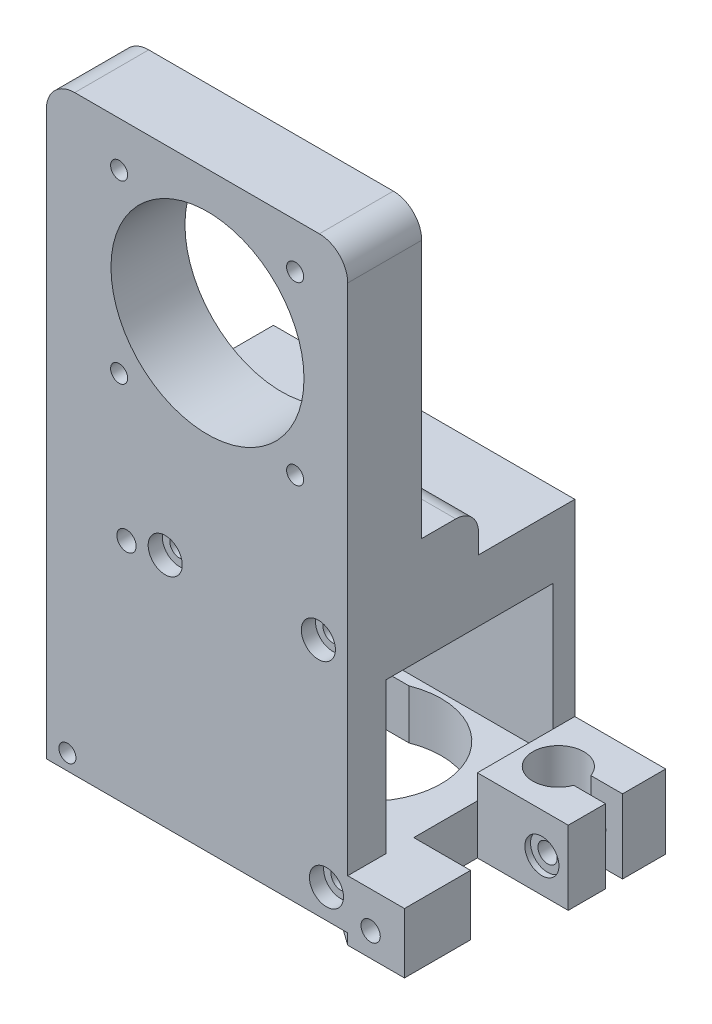
from build123d import *
from OCP.BRepAlgoAPI import BRepAlgoAPI_Cut
from OCP.TopTools import TopTools_ListOfShape

# Parameters (mm, degrees)
SKETCH1_W                     = 45
SKETCH1_H                     = 45
BOSS_EXTRUDE1_DEPTH           = 35
SKETCH2_R                     = 13
CUT_EXTRUDE3_DEPTH            = 35
SKETCH4_R                     = 1.7
CUT_EXTRUDE8_DEPTH            = 35
SKETCH7_R                     = 1.7
CUT_EXTRUDE9_DEPTH            = 35
SKETCH6_R                     = 1.7
CUT_EXTRUDE10_DEPTH           = 35
SKETCH5_R                     = 1.7
CUT_EXTRUDE11_DEPTH           = 35
CUT_EXTRUDE12_DEPTH           = 12
BOSS_EXTRUDE4_DEPTH           = 2
BOSS_EXTRUDE4_DEPTH_BACK      = 37.5
SKETCH14_W                    = 6
SKETCH14_H                    = 6
CUT_EXTRUDE17_START           = -7
SKETCH20_R                    = 2.2
CUT_EXTRUDE17_DEPTH           = 70.77141069
SKETCH21_R                    = 1.75
CUT_EXTRUDE18_DEPTH           = 2
BOSS_EXTRUDE5_DEPTH           = 44.571207257
BOSS_EXTRUDE5_DEPTH_BACK      = 1.562633388
SKETCH22_W                    = 53.082637552
SKETCH22_H                    = 40.002520942
SKETCH23_W                    = 29.449729346
SKETCH23_H                    = 26.517519529
CUT_EXTRUDE19_DEPTH           = 95.427299018
SKETCH25_R                    = 5
CUT_EXTRUDE24_DEPTH           = 2.6
SKETCH26_R                    = 8.1
CUT_EXTRUDE25_DEPTH           = 4
SKETCH27_R                    = 6.7
CUT_EXTRUDE28_DEPTH           = 6
SKETCH30_R                    = 13
CUT_EXTRUDE30_DEPTH           = 10.767560088
SKETCH31_W                    = 19.349450051
SKETCH31_H                    = 23.644133728
CUT_EXTRUDE31_DEPTH           = 9.664293754
SKETCH34_R                    = 1.5
CUT_EXTRUDE32_DEPTH           = 9
SKETCH37_W                    = 11.635024897
SKETCH37_H                    = 10.599921236
BOSS_EXTRUDE6_DEPTH           = 10
BOSS_EXTRUDE6_OTHER_WAY_DEPTH = 5
BOSS_EXTRUDE6_OTHER_WAY_TAPER = 29
SKETCH38_R                    = 1.700000001
CUT_EXTRUDE33_DEPTH           = 10
SKETCH39_R                    = 1.700000001
CUT_EXTRUDE34_DEPTH           = 88.0662855
SKETCH40_W                    = 17.159872711
SKETCH40_H                    = 13
BOSS_EXTRUDE7_DEPTH           = 16
SKETCH41_R                    = 4.5
CUT_EXTRUDE35_DEPTH           = 15
SKETCH42_W                    = 9.331425876
SKETCH42_H                    = 3
CUT_EXTRUDE36_DEPTH           = 15
CUT_EXTRUDE37_DEPTH           = 5
SKETCH44_R                    = 1.7
CUT_EXTRUDE38_DEPTH           = 23
CUT_EXTRUDE39_DEPTH           = 5
CUT_EXTRUDE40_DEPTH           = 5
CUT_EXTRUDE41_DEPTH           = 5
SKETCH53_R                    = 1.7
CUT_EXTRUDE42_DEPTH           = 90.646740997
SKETCH52_R                    = 1.7
CUT_EXTRUDE43_DEPTH           = 90.646740997
SKETCH51_R                    = 1.7
CUT_EXTRUDE44_DEPTH           = 90.646740997
CUT_EXTRUDE46_DEPTH           = 5
SKETCH57_R                    = 3
CUT_EXTRUDE48_DEPTH           = 2.5
SKETCH58_R                    = 3
CUT_EXTRUDE49_DEPTH           = 2.5
SKETCH59_R                    = 3
CUT_EXTRUDE50_DEPTH           = 2.5
SKETCH60_R                    = 3
CUT_EXTRUDE51_DEPTH           = 1
SKETCH61_W                    = 6.542017971
SKETCH61_H                    = 14.030300317
CUT_EXTRUDE52_DEPTH           = 6.5
SKETCH67_W                    = 5.604230097
SKETCH67_H                    = 8.996545788
BOSS_EXTRUDE8_DEPTH           = 33
SKETCH68_W                    = 5.604230097
SKETCH68_H                    = 9.400155495
BOSS_EXTRUDE9_DEPTH           = 33
SKETCH63_R                    = 1.7
CUT_EXTRUDE55_DEPTH           = 102.92049818
SKETCH62_R                    = 1.7
CUT_EXTRUDE56_DEPTH           = 102.92049818
SKETCH69_R                    = 3
CUT_EXTRUDE57_DEPTH           = 2.5
CUT_EXTRUDE58_DEPTH           = 2.5
SKETCH71_R                    = 3
CUT_EXTRUDE59_DEPTH           = 1
SKETCH73_R                    = 1.5
CUT_EXTRUDE61_DEPTH           = 5
SKETCH79_W                    = 95.658931194
SKETCH79_H                    = 51.290788201
CUT_EXTRUDE62_DEPTH           = 59
SKETCH80_W                    = 53.082637552
SKETCH80_H                    = 13.031868173
BOSS_EXTRUDE10_DEPTH          = 58
FILLET1_R                     = 5
SKETCH84_R                    = 17
CUT_EXTRUDE63_DEPTH           = 22
SKETCH85_R                    = 1.5
CUT_EXTRUDE64_DEPTH           = 15
SKETCH86_W                    = 13.696128452
SKETCH86_H                    = 10
BOSS_EXTRUDE11_DEPTH          = 7.5
FILLET3_R                     = 3
SKETCH87_W                    = 10.765748292
SKETCH87_H                    = 10
BOSS_EXTRUDE12_DEPTH          = 7.5
FILLET6_R                     = 4


with BuildPart() as part:
    # Sketch1 → Boss-Extrude1 (new body)
    with BuildSketch(Plane.XY):
        Rectangle(SKETCH1_W, SKETCH1_H)
    extrude(amount=BOSS_EXTRUDE1_DEPTH)

    # Sketch2 → Cut-Extrude3 (cut)
    with BuildSketch(Plane.XY.offset(35)):
        Circle(SKETCH2_R)
    extrude(amount=-CUT_EXTRUDE3_DEPTH, mode=Mode.SUBTRACT)

    # Sketch4 → Cut-Extrude8 (cut)
    with BuildSketch(Plane(origin=(0, 0, 0), x_dir=(-1, 0, 0), z_dir=(0, 0, -1))):
        with Locations((-15.808862622, 15.928817575)):
            Circle(SKETCH4_R)
    extrude(amount=-CUT_EXTRUDE8_DEPTH, mode=Mode.SUBTRACT)

    # Sketch7 → Cut-Extrude9 (cut)
    with BuildSketch(Plane(origin=(0, 0, 0), x_dir=(-1, 0, 0), z_dir=(0, 0, -1))):
        with Locations((15.199970606, 15.923392722)):
            Circle(SKETCH7_R)
    extrude(amount=-CUT_EXTRUDE9_DEPTH, mode=Mode.SUBTRACT)

    # Sketch6 → Cut-Extrude10 (cut)
    with BuildSketch(Plane(origin=(0, 0, 0), x_dir=(-1, 0, 0), z_dir=(0, 0, -1))):
        with Locations((15.22029943, -15.065721832)):
            Circle(SKETCH6_R)
    extrude(amount=-CUT_EXTRUDE10_DEPTH, mode=Mode.SUBTRACT)

    # Sketch5 → Cut-Extrude11 (cut)
    with BuildSketch(Plane(origin=(0, 0, 0), x_dir=(-1, 0, 0), z_dir=(0, 0, -1))):
        with Locations((-15.781319068, -15.06525873)):
            Circle(SKETCH5_R)
    extrude(amount=-CUT_EXTRUDE11_DEPTH, mode=Mode.SUBTRACT)

    # Sketch8 → Cut-Extrude12 (cut)
    with BuildSketch(Plane(origin=(22.5, 0, 0), x_dir=(0, 0, -1), z_dir=(1, 0, 0))):
        Polygon((-4.363915061, -12.036124724), (-35, -12.036124724), (-35, 22.5), (-8.423058519, 22.5), (-8.423058519, 12.925541512), (-4.363915061, 12.925541512), align=None)
    extrude(amount=-CUT_EXTRUDE12_DEPTH, mode=Mode.SUBTRACT)

    # Sketch14 → Boss-Extrude4 (add, two sides: drawn at the far end of the back side and taken through both)
    with BuildSketch(Plane(origin=(0, 22.5, 0), x_dir=(1, 0, 0), z_dir=(0, 1, 0)).offset(-BOSS_EXTRUDE4_DEPTH_BACK)):
        with Locations((6.190916669, -17.729312446)):
            Rectangle(SKETCH14_W, SKETCH14_H)
    extrude(amount=BOSS_EXTRUDE4_DEPTH + BOSS_EXTRUDE4_DEPTH_BACK)

    # Sketch20 → Cut-Extrude17 (cut)
    with BuildSketch(Plane(origin=(0, 24.5, 0), x_dir=(1, 0, 0), z_dir=(0, 1, 0)).offset(CUT_EXTRUDE17_START)):
        with Locations((6.190916669, -17.729312446)):
            Circle(SKETCH20_R)
    cut_extrude17 = extrude(amount=CUT_EXTRUDE17_DEPTH, mode=Mode.SUBTRACT)

    # Sketch21 → Cut-Extrude18 (cut)
    with BuildSketch(Plane(origin=(0, 17.5, 0), x_dir=(1, 0, 0), z_dir=(0, 1, 0))):
        with Locations((6.190916669, -17.729312446)):
            Circle(SKETCH21_R)
    extrude(amount=-CUT_EXTRUDE18_DEPTH, mode=Mode.SUBTRACT)

    # Mirror6: Cut-Extrude17 across plane
    add(cut_extrude17.mirror(Plane.ZX.offset(16.5)), mode=Mode.SUBTRACT)

    # Sketch22 → Boss-Extrude5 (add, two sides: drawn at the far end of the back side and taken through both)
    with BuildSketch(Plane.XZ.offset(22.5).offset(-BOSS_EXTRUDE5_DEPTH_BACK)):
        with Locations((-1.541318776, 20.001258793)):
            Rectangle(SKETCH22_W, SKETCH22_H)
    extrude(amount=BOSS_EXTRUDE5_DEPTH + BOSS_EXTRUDE5_DEPTH_BACK)

    # Sketch23 → Cut-Extrude19 (cut, through all)
    with BuildSketch(Plane.ZY.offset(28.082637552)):
        with Locations((18.529138975, -45.100264067)):
            Rectangle(SKETCH23_W, SKETCH23_H)
    extrude(amount=-CUT_EXTRUDE19_DEPTH, mode=Mode.SUBTRACT)

    # Sketch25 → Cut-Extrude24 (cut)
    with BuildSketch(Plane(origin=(0, -20.937366612, 0), x_dir=(1, 0, 0), z_dir=(0, 1, 0))):
        with Locations((6.190916669, -17.729312446)):
            Circle(SKETCH25_R)
    extrude(amount=-CUT_EXTRUDE24_DEPTH, mode=Mode.SUBTRACT)

    # Sketch26 → Cut-Extrude25 (cut)
    with BuildSketch(Plane(origin=(0, -23.537366612, 0), x_dir=(1, 0, 0), z_dir=(0, 1, 0))):
        with Locations((6.190916669, -17.729312446)):
            Circle(SKETCH26_R)
    extrude(amount=-CUT_EXTRUDE25_DEPTH, mode=Mode.SUBTRACT)

    # Sketch27 → Cut-Extrude28 (cut)
    with BuildSketch(Plane(origin=(0, -27.537366612, 0), x_dir=(1, 0, 0), z_dir=(0, 1, 0))):
        with Locations((6.190916669, -17.729312446)):
            Circle(SKETCH27_R)
    extrude(amount=-CUT_EXTRUDE28_DEPTH, mode=Mode.SUBTRACT)

    # Sketch30 → Cut-Extrude30 (cut)
    with BuildSketch(Plane(origin=(0, -58.359023831, 0), x_dir=(1, 0, 0), z_dir=(0, 1, 0))):
        with Locations((6.207851035, -17.729312446)):
            Circle(SKETCH30_R)
    extrude(amount=-CUT_EXTRUDE30_DEPTH, mode=Mode.SUBTRACT)

    # Sketch31 → Cut-Extrude31 (cut)
    with BuildSketch(Plane.XZ.offset(67.071207257)):
        with Locations((-7.592166715, 17.462222744)):
            Rectangle(SKETCH31_W, SKETCH31_H)
    extrude(amount=-CUT_EXTRUDE31_DEPTH, mode=Mode.SUBTRACT)

    # Sketch34 → Cut-Extrude32 (cut)
    with BuildSketch(Plane.ZY.offset(28.082637552)):
        with Locations((35.530918006, -28.494957131)):
            Circle(SKETCH34_R)
        with Locations((3.530918006, -28.494957131)):
            Circle(SKETCH34_R)
        with Locations((35.530918006, -60.494957131)):
            Circle(SKETCH34_R)
        with Locations((3.530918006, -60.494957131)):
            Circle(SKETCH34_R)
    extrude(amount=-CUT_EXTRUDE32_DEPTH, mode=Mode.SUBTRACT)

    # Sketch37 → Boss-Extrude6 (add)
    with BuildSketch(Plane(origin=(25, 0, 0), x_dir=(0, 0, -1), z_dir=(1, 0, 0))):
        with Locations((-34.185004037, -63.658986353)):
            Rectangle(SKETCH37_W, SKETCH37_H)
    extrude(amount=BOSS_EXTRUDE6_DEPTH)

    # Sketch37 → Boss-Extrude6 other way (add)
    with BuildSketch(Plane(origin=(25, 0, 0), x_dir=(0, 0, -1), z_dir=(1, 0, 0))):
        with Locations((-34.185004037, -63.658986353)):
            Rectangle(SKETCH37_W, SKETCH37_H)
    extrude(amount=-BOSS_EXTRUDE6_OTHER_WAY_DEPTH, taper=BOSS_EXTRUDE6_OTHER_WAY_TAPER)

    # Sketch38 → Cut-Extrude33 (cut)
    with BuildSketch(Plane.XY.offset(40.002519264)):
        with Locations((29.034907303, -64.748396147)):
            Circle(SKETCH38_R)
    extrude(amount=-CUT_EXTRUDE33_DEPTH, mode=Mode.SUBTRACT)

    # Sketch39 → Cut-Extrude34 (cut, through all)
    with BuildSketch(Plane.XY.offset(40.002519264)):
        with Locations((-13.965092697, -26.748396147)):
            Circle(SKETCH39_R)
    extrude(amount=-CUT_EXTRUDE34_DEPTH, mode=Mode.SUBTRACT)

    # Sketch40 → Boss-Extrude7 (add)
    with BuildSketch(Plane(origin=(25, 0, 0), x_dir=(0, 0, -1), z_dir=(1, 0, 0))):
        with Locations((-8.579933523, -60.571207257)):
            Rectangle(SKETCH40_W, SKETCH40_H)
    extrude(amount=BOSS_EXTRUDE7_DEPTH)

    # Sketch41 → Cut-Extrude35 (cut)
    with BuildSketch(Plane(origin=(0, -54.071207257, 1.269334023), x_dir=(1, 0, 0), z_dir=(0, 1, 0))):
        with Locations((31.163890056, -7.793414205)):
            Circle(SKETCH41_R)
    extrude(amount=-CUT_EXTRUDE35_DEPTH, mode=Mode.SUBTRACT)

    # Sketch42 → Cut-Extrude36 (cut)
    with BuildSketch(Plane(origin=(0, -54.071207257, 0), x_dir=(1, 0, 0), z_dir=(0, 1, 0))):
        with Locations((38.19390682, -9.095710432)):
            Rectangle(SKETCH42_W, SKETCH42_H)
    extrude(amount=-CUT_EXTRUDE36_DEPTH, mode=Mode.SUBTRACT)


with BuildPart() as cut_extrude37_tool:
    # Sketch43 → Cut-Extrude37 (new body)
    with BuildSketch(Plane(origin=(0, 0, 0), x_dir=(-1, 0, 0), z_dir=(0, 0, -1))):
        Polygon((-34.628927379, -64.403909926), (-32.738460245, -61.095415705), (-34.658466721, -57.80397603), (-38.468940333, -57.821030577), (-40.359407467, -61.129524799), (-38.439400991, -64.420964473), align=None)
    extrude(amount=-CUT_EXTRUDE37_DEPTH)


with BuildPart() as part_1:
    add(part.part)

    # Cut-Extrude37: cut by cut_extrude37_tool, with a tolerance
    cut_extrude37_stock = TopTools_ListOfShape()
    cut_extrude37_stock.Append(part_1.part.wrapped)
    cut_extrude37_tools = TopTools_ListOfShape()
    cut_extrude37_tools.Append(cut_extrude37_tool.part.wrapped)
    cut_extrude37_cut = BRepAlgoAPI_Cut()
    cut_extrude37_cut.SetArguments(cut_extrude37_stock)
    cut_extrude37_cut.SetTools(cut_extrude37_tools)
    cut_extrude37_cut.SetFuzzyValue(0.00001)
    cut_extrude37_cut.Build()
    add(Compound.cast(cut_extrude37_cut.Shape()).solids(), mode=Mode.REPLACE)

    # Sketch44 → Cut-Extrude38 (cut)
    with BuildSketch(Plane.XY.offset(17.159869878)):
        with Locations((36.360549159, -61.087091915)):
            Circle(SKETCH44_R)
    extrude(amount=-CUT_EXTRUDE38_DEPTH, mode=Mode.SUBTRACT)


with BuildPart() as cut_extrude39_tool:
    # Sketch48 → Cut-Extrude39 (new body)
    with BuildSketch(Plane(origin=(0, 0, 0), x_dir=(-1, 0, 0), z_dir=(0, 0, -1))):
        Polygon((9.066729233, -28.811078933), (10.957196368, -25.502584711), (9.037189891, -22.211145037), (5.22671628, -22.228199584), (3.336249145, -25.536693806), (5.256255622, -28.82813348), align=None)
    extrude(amount=-CUT_EXTRUDE39_DEPTH)


with BuildPart() as part_2:
    add(part_1.part)

    # Cut-Extrude39: cut by cut_extrude39_tool, with a tolerance
    cut_extrude39_stock = TopTools_ListOfShape()
    cut_extrude39_stock.Append(part_2.part.wrapped)
    cut_extrude39_tools = TopTools_ListOfShape()
    cut_extrude39_tools.Append(cut_extrude39_tool.part.wrapped)
    cut_extrude39_cut = BRepAlgoAPI_Cut()
    cut_extrude39_cut.SetArguments(cut_extrude39_stock)
    cut_extrude39_cut.SetTools(cut_extrude39_tools)
    cut_extrude39_cut.SetFuzzyValue(0.00001)
    cut_extrude39_cut.Build()
    add(Compound.cast(cut_extrude39_cut.Shape()).solids(), mode=Mode.REPLACE)


with BuildPart() as cut_extrude40_tool:
    # Sketch49 → Cut-Extrude40 (new body)
    with BuildSketch(Plane(origin=(0, 0, 0), x_dir=(-1, 0, 0), z_dir=(0, 0, -1))):
        Polygon((-19.339505263, -65.26594849), (-17.449038128, -61.957454268), (-19.369044605, -58.666014594), (-23.179518216, -58.683069141), (-25.06998535, -61.991563363), (-23.149978874, -65.283003037), align=None)
    extrude(amount=-CUT_EXTRUDE40_DEPTH)


with BuildPart() as part_3:
    add(part_2.part)

    # Cut-Extrude40: cut by cut_extrude40_tool, with a tolerance
    cut_extrude40_stock = TopTools_ListOfShape()
    cut_extrude40_stock.Append(part_3.part.wrapped)
    cut_extrude40_tools = TopTools_ListOfShape()
    cut_extrude40_tools.Append(cut_extrude40_tool.part.wrapped)
    cut_extrude40_cut = BRepAlgoAPI_Cut()
    cut_extrude40_cut.SetArguments(cut_extrude40_stock)
    cut_extrude40_cut.SetTools(cut_extrude40_tools)
    cut_extrude40_cut.SetFuzzyValue(0.00001)
    cut_extrude40_cut.Build()
    add(Compound.cast(cut_extrude40_cut.Shape()).solids(), mode=Mode.REPLACE)


with BuildPart() as cut_extrude41_tool:
    # Sketch50 → Cut-Extrude41 (new body)
    with BuildSketch(Plane(origin=(0, 0, 0), x_dir=(-1, 0, 0), z_dir=(0, 0, -1))):
        Polygon((-17.911640095, -28.243498116), (-16.02117296, -24.935003895), (-17.941179437, -21.64356422), (-21.751653048, -21.660618767), (-23.642120183, -24.969112989), (-21.722113706, -28.260552663), align=None)
    extrude(amount=-CUT_EXTRUDE41_DEPTH)


with BuildPart() as part_4:
    add(part_3.part)

    # Cut-Extrude41: cut by cut_extrude41_tool, with a tolerance
    cut_extrude41_stock = TopTools_ListOfShape()
    cut_extrude41_stock.Append(part_4.part.wrapped)
    cut_extrude41_tools = TopTools_ListOfShape()
    cut_extrude41_tools.Append(cut_extrude41_tool.part.wrapped)
    cut_extrude41_cut = BRepAlgoAPI_Cut()
    cut_extrude41_cut.SetArguments(cut_extrude41_stock)
    cut_extrude41_cut.SetTools(cut_extrude41_tools)
    cut_extrude41_cut.SetFuzzyValue(0.00001)
    cut_extrude41_cut.Build()
    add(Compound.cast(cut_extrude41_cut.Shape()).solids(), mode=Mode.REPLACE)

    # Sketch53 → Cut-Extrude42 (cut, through all)
    with BuildSketch(Plane.XY.offset(40.002519264)):
        with Locations((21.259511739, -61.974508816)):
            Circle(SKETCH53_R)
    extrude(amount=-CUT_EXTRUDE42_DEPTH, mode=Mode.SUBTRACT)

    # Sketch52 → Cut-Extrude43 (cut, through all)
    with BuildSketch(Plane.XY.offset(40.002519264)):
        with Locations((19.831646572, -24.952058442)):
            Circle(SKETCH52_R)
    extrude(amount=-CUT_EXTRUDE43_DEPTH, mode=Mode.SUBTRACT)

    # Sketch51 → Cut-Extrude44 (cut, through all)
    with BuildSketch(Plane.XY.offset(40.002519264)):
        with Locations((-7.146722757, -25.519639258)):
            Circle(SKETCH51_R)
    extrude(amount=-CUT_EXTRUDE44_DEPTH, mode=Mode.SUBTRACT)


with BuildPart() as cut_extrude46_tool:
    # Sketch55 → Cut-Extrude46 (new body)
    with BuildSketch(Plane(origin=(0, 0, 0), x_dir=(-1, 0, 0), z_dir=(0, 0, -1))):
        Polygon((16.745274795, -30.164507999), (18.313623392, -26.048743749), (15.533441294, -22.632631898), (11.1849106, -23.332284296), (9.616562003, -27.448048545), (12.396744101, -30.864160397), align=None)
    extrude(amount=-CUT_EXTRUDE46_DEPTH)


with BuildPart() as part_5:
    add(part_4.part)

    # Cut-Extrude46: cut by cut_extrude46_tool, with a tolerance
    cut_extrude46_stock = TopTools_ListOfShape()
    cut_extrude46_stock.Append(part_5.part.wrapped)
    cut_extrude46_tools = TopTools_ListOfShape()
    cut_extrude46_tools.Append(cut_extrude46_tool.part.wrapped)
    cut_extrude46_cut = BRepAlgoAPI_Cut()
    cut_extrude46_cut.SetArguments(cut_extrude46_stock)
    cut_extrude46_cut.SetTools(cut_extrude46_tools)
    cut_extrude46_cut.SetFuzzyValue(0.00001)
    cut_extrude46_cut.Build()
    add(Compound.cast(cut_extrude46_cut.Shape()).solids(), mode=Mode.REPLACE)

    # Sketch57 → Cut-Extrude48 (cut)
    with BuildSketch(Plane.XY.offset(40.002519264)):
        with Locations((-7.146722757, -25.519639258)):
            Circle(SKETCH57_R)
    extrude(amount=-CUT_EXTRUDE48_DEPTH, mode=Mode.SUBTRACT)

    # Sketch58 → Cut-Extrude49 (cut)
    with BuildSketch(Plane.XY.offset(40.002519264)):
        with Locations((19.831646572, -24.952058442)):
            Circle(SKETCH58_R)
    extrude(amount=-CUT_EXTRUDE49_DEPTH, mode=Mode.SUBTRACT)

    # Sketch59 → Cut-Extrude50 (cut)
    with BuildSketch(Plane.XY.offset(40.002519264)):
        with Locations((21.259511739, -61.974508816)):
            Circle(SKETCH59_R)
    extrude(amount=-CUT_EXTRUDE50_DEPTH, mode=Mode.SUBTRACT)

    # Sketch60 → Cut-Extrude51 (cut)
    with BuildSketch(Plane(origin=(0, 0, 0), x_dir=(-1, 0, 0), z_dir=(0, 0, -1))):
        with Locations((-15.808862622, 15.928817575)):
            Circle(SKETCH60_R)
        with Locations((15.199970606, 15.923392722)):
            Circle(SKETCH60_R)
        with Locations((-15.781319068, -15.06525873)):
            Circle(SKETCH60_R)
        with Locations((15.22029943, -15.065721832)):
            Circle(SKETCH60_R)
    extrude(amount=-CUT_EXTRUDE51_DEPTH, mode=Mode.SUBTRACT)

    # Sketch61 → Cut-Extrude52 (cut)
    with BuildSketch(Plane(origin=(9.190916669, 0, 0), x_dir=(0, 0, -1), z_dir=(1, 0, 0))):
        with Locations((-17.812553374, 0.202623489)):
            Rectangle(SKETCH61_W, SKETCH61_H)
    extrude(amount=-CUT_EXTRUDE52_DEPTH, mode=Mode.SUBTRACT)

    # Sketch67 → Boss-Extrude8 (add)
    with BuildSketch(Plane(origin=(-22.5, -2.468350024, 0), x_dir=(0, 0, 1), z_dir=(-1, 0, 0))):
        with Locations((29.51622543, -5.940778019)):
            Rectangle(SKETCH67_W, SKETCH67_H)
    extrude(amount=-BOSS_EXTRUDE8_DEPTH)

    # Sketch68 → Boss-Extrude9 (add)
    with BuildSketch(Plane(origin=(-22.5, -2.468350024, 0), x_dir=(0, 0, 1), z_dir=(-1, 0, 0))):
        with Locations((9.47264346, -5.966332429)):
            Rectangle(SKETCH68_W, SKETCH68_H)
    extrude(amount=-BOSS_EXTRUDE9_DEPTH)

    # Sketch63 → Cut-Extrude55 (cut, through all)
    with BuildSketch(Plane.ZY.offset(22.5)):
        with Locations((29.516225429, -7.068802512)):
            Circle(SKETCH63_R)
    extrude(amount=-CUT_EXTRUDE55_DEPTH, mode=Mode.SUBTRACT)

    # Sketch62 → Cut-Extrude56 (cut, through all)
    with BuildSketch(Plane.ZY.offset(22.5)):
        with Locations((9.403782955, -7.127149089)):
            Circle(SKETCH62_R)
    extrude(amount=-CUT_EXTRUDE56_DEPTH, mode=Mode.SUBTRACT)

    # Sketch69 → Cut-Extrude57 (cut)
    with BuildSketch(Plane.ZY.offset(22.5)):
        with Locations((9.403782955, -7.127149089)):
            Circle(SKETCH69_R)
        with Locations((29.516225429, -7.068802512)):
            Circle(SKETCH69_R)
    extrude(amount=-CUT_EXTRUDE57_DEPTH, mode=Mode.SUBTRACT)

    # Sketch70 → Cut-Extrude58 (cut)
    with BuildSketch(Plane(origin=(0, 0, 28.367491588), x_dir=(-1, 0, 0), z_dir=(0, 0, -1))):
        Polygon((-25.057295961, -66.811454801), (-25.259440428, -62.335213005), (-29.23705177, -60.272154352), (-33.012518645, -62.685337494), (-32.810374177, -67.161579289), (-28.832762835, -69.224637943), align=None)
    extrude(amount=-CUT_EXTRUDE58_DEPTH, mode=Mode.SUBTRACT)

    # Sketch71 → Cut-Extrude59 (cut)
    with BuildSketch(Plane.XY.offset(17.159869878)):
        with Locations((36.360549159, -61.087091915)):
            Circle(SKETCH71_R)
    extrude(amount=-CUT_EXTRUDE59_DEPTH, mode=Mode.SUBTRACT)

    # Sketch73 → Cut-Extrude61 (cut)
    with BuildSketch(Plane.XY.offset(40.002519264)):
        with Locations((-24.369276222, -64.32278971)):
            Circle(SKETCH73_R)
    extrude(amount=-CUT_EXTRUDE61_DEPTH, mode=Mode.SUBTRACT)

    # Sketch79 → Cut-Extrude62 (cut)
    with BuildSketch(Plane(origin=(0, -20.937366612, 0), x_dir=(1, 0, 0), z_dir=(0, 1, 0))):
        with Locations((-4.270574665, -23.740541644)):
            Rectangle(SKETCH79_W, SKETCH79_H)
    extrude(amount=CUT_EXTRUDE62_DEPTH, mode=Mode.SUBTRACT)

    # Sketch80 → Boss-Extrude10 (add)
    with BuildSketch(Plane(origin=(0, -20.937366612, 0), x_dir=(1, 0, 0), z_dir=(0, 1, 0))):
        with Locations((-1.541318776, -33.486585178)):
            Rectangle(SKETCH80_W, SKETCH80_H)
    extrude(amount=BOSS_EXTRUDE10_DEPTH)

    # Fillet1
    fillet1_edges = [part_5.edges().sort_by_distance(p)[0] for p in [
        (-28.082637552, 37.062633388, 33.486585177),
        (25, 37.062633388, 33.486585177),
    ]]
    fillet(fillet1_edges, radius=FILLET1_R)

    # Sketch84 → Cut-Extrude63 (cut)
    with BuildSketch(Plane(origin=(0, 0, 26.970651091), x_dir=(-1, 0, 0), z_dir=(0, 0, -1))):
        with Locations((-0.29898878, 13.603645853)):
            Circle(SKETCH84_R)
    extrude(amount=-CUT_EXTRUDE63_DEPTH, mode=Mode.SUBTRACT)

    # Sketch85 → Cut-Extrude64 (cut)
    with BuildSketch(Plane.XY.offset(40.002519264)):
        with Locations((15.736832887, 29.13557467)):
            Circle(SKETCH85_R)
        with Locations((15.736832887, -1.86442533)):
            Circle(SKETCH85_R)
        with Locations((-15.263167113, -1.86442533)):
            Circle(SKETCH85_R)
        with Locations((-15.263167113, 29.13557467)):
            Circle(SKETCH85_R)
    extrude(amount=-CUT_EXTRUDE64_DEPTH, mode=Mode.SUBTRACT)

    # Sketch86 → Boss-Extrude11 (add)
    with BuildSketch(Plane(origin=(0, -20.937366612, 0), x_dir=(1, 0, 0), z_dir=(0, 1, 0))):
        with Locations((-21.234573326, -21.970651091)):
            Rectangle(SKETCH86_W, SKETCH86_H)
    extrude(amount=BOSS_EXTRUDE11_DEPTH)

    # Fillet3
    fillet3_edges = [part_5.edges().sort_by_distance(p)[0] for p in [
        (-21.234573326, -13.437366612, 16.970651091),
    ]]
    fillet(fillet3_edges, radius=FILLET3_R)

    # Sketch87 → Boss-Extrude12 (add)
    with BuildSketch(Plane(origin=(0, -20.937366612, 0), x_dir=(1, 0, 0), z_dir=(0, 1, 0))):
        with Locations((19.617125854, -21.970651091)):
            Rectangle(SKETCH87_W, SKETCH87_H)
    extrude(amount=BOSS_EXTRUDE12_DEPTH)

    # Fillet6
    fillet6_edges = [part_5.edges().sort_by_distance(p)[0] for p in [
        (19.617125854, -13.437366612, 16.970651091),
    ]]
    fillet(fillet6_edges, radius=FILLET6_R)


solid = part_5.part
